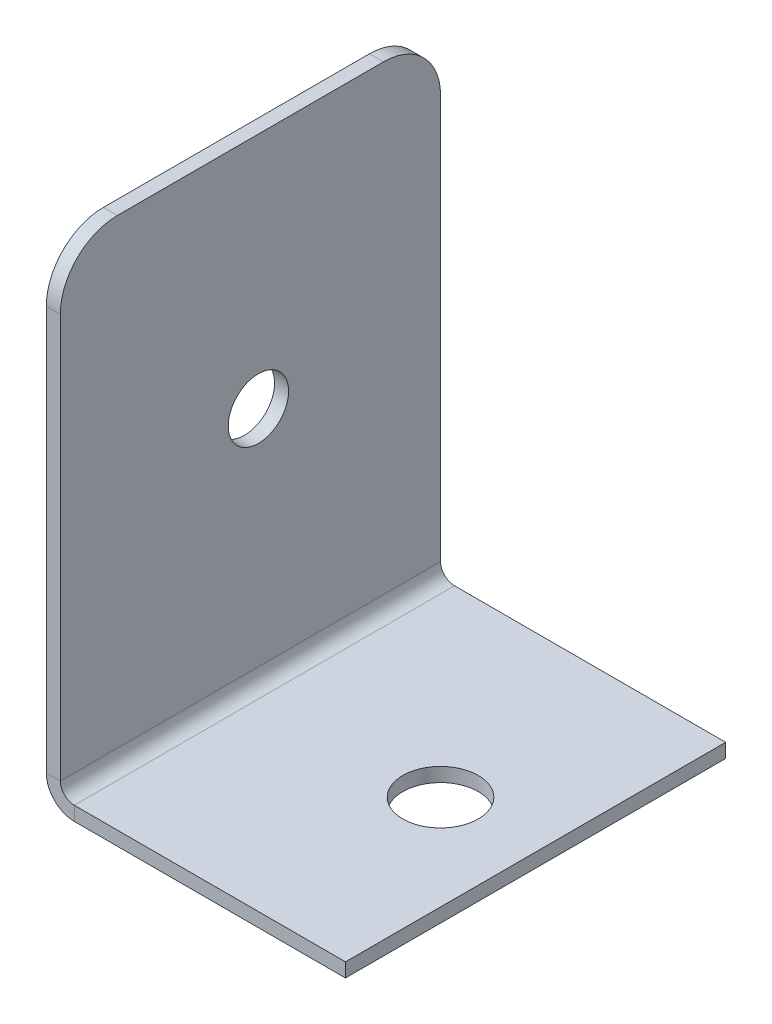
from build123d import *

# Parameters (mm, degrees)
BASE_FLANGE1_DEPTH = 10
SKETCH7_R          = 1.5875
CUT_EXTRUDE1_DEPTH = 31.822070015
SKETCH8_R          = 1.984375
CUT_EXTRUDE2_DEPTH = 31.822070015
FILLET1_R          = 3


# Sheet-metal steps are written as plain solids
with BuildPart() as part:
    # Sketch2 → Base-Flange1 (new, symmetric)
    with BuildSketch(Plane.XY):
        with BuildLine():
            Line((0, 25), (0, 0.7366))
            ThreePointArc((0, 0.7366), (0.215745145, 0.215745145), (0.7366, 0))
            Line((0.7366, 0), (15, 0))
            Line((15, 0), (15, -0.7366))
            Line((15, -0.7366), (0.7366, -0.7366))
            ThreePointArc((0.7366, -0.7366), (-0.30510971, -0.30510971), (-0.7366, 0.7366))
            Line((-0.7366, 0.7366), (-0.7366, 25))
            Line((-0.7366, 25), (0, 25))
        make_face()
    extrude(amount=BASE_FLANGE1_DEPTH, both=True)

    # Sketch7 → Cut-Extrude1 (cut, through all)
    with BuildSketch(Plane(origin=(0, 0, 0), x_dir=(0, 0, -1), z_dir=(1, 0, 0))):
        with Locations(Location((0.42, 12.4934, 0), (0, 0, 90))):
            Circle(SKETCH7_R)
    extrude(amount=-CUT_EXTRUDE1_DEPTH, mode=Mode.SUBTRACT)

    # Sketch8 → Cut-Extrude2 (cut, through all)
    with BuildSketch(Plane(origin=(0, 0, 0), x_dir=(1, 0, 0), z_dir=(0, 1, 0))):
        with Locations(Location((10, 0, 0), (0, 0, 270))):
            Circle(SKETCH8_R)
    extrude(amount=-CUT_EXTRUDE2_DEPTH, mode=Mode.SUBTRACT)

    # Fillet1
    fillet1_edges = [part.edges().sort_by_distance(p)[0] for p in [
        (-0.3683, 25, 10),
        (-0.3683, 25, -10),
    ]]
    fillet(fillet1_edges, radius=FILLET1_R)


solid = part.part
